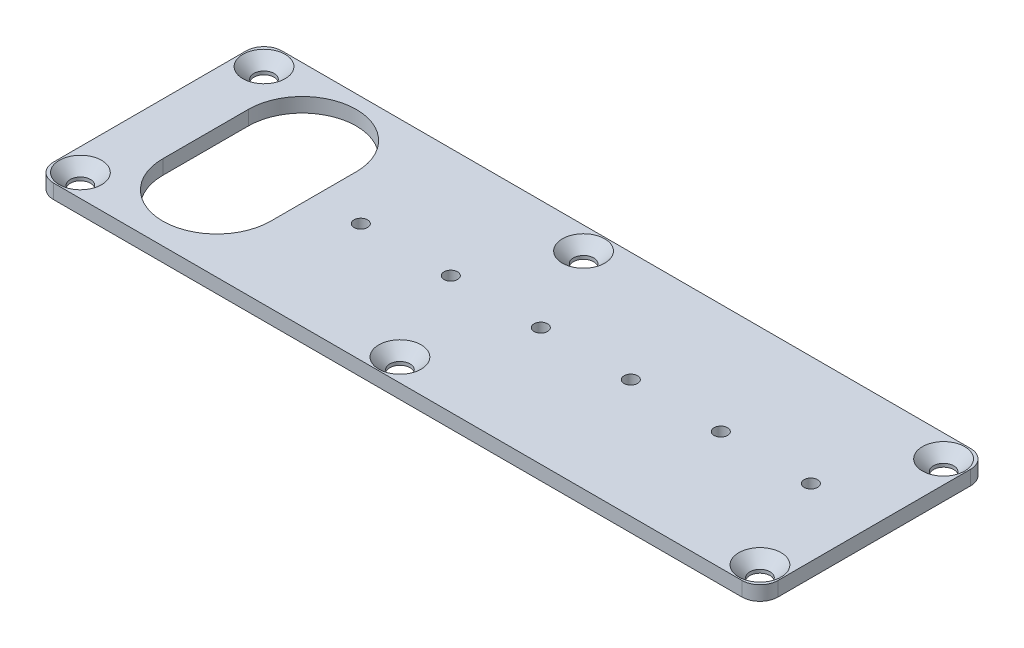
from build123d import *

# Parameters (mm, degrees)
SKETCH1_W                                       = 161
SKETCH1_H                                       = 50.8
BOSS_EXTRUDE1_DEPTH                             = 3.2
SKETCH2_R                                       = 1.5
CUT_EXTRUDE2_DEPTH                              = 169.854612019
FILLET1_R                                       = 4
CSK_FOR_M4_FLAT_HEAD_MACHINE_SCREW1_D           = 4.5
CSK_FOR_M4_FLAT_HEAD_MACHINE_SCREW1_DEPTH       = 5
CSK_FOR_M4_FLAT_HEAD_MACHINE_SCREW1_CSINK_D     = 9.4
CSK_FOR_M4_FLAT_HEAD_MACHINE_SCREW1_CSINK_ANGLE = 90
CSK_FOR_M4_FLAT_HEAD_MACHINE_SCREW1_TIP         = 1.351936393


with BuildPart() as part:
    # Sketch1 → Boss-Extrude1 (new body)
    with BuildSketch(Plane(origin=(0, 0, 0), x_dir=(1, 0, 0), z_dir=(0, 1, 0))):
        with Locations((80.5, 25.4)):
            Rectangle(SKETCH1_W, SKETCH1_H)
    extrude(amount=BOSS_EXTRUDE1_DEPTH)

    # Sketch2 → Cut-Extrude2 (cut, through all)
    with BuildSketch(Plane(origin=(0, 3.2, 0), x_dir=(1, 0, 0), z_dir=(0, 1, 0))):
        with Locations((146, 26.3)):
            Circle(SKETCH2_R)
        with Locations((126, 26.3)):
            Circle(SKETCH2_R)
        with Locations((106, 26.3)):
            Circle(SKETCH2_R)
        with Locations((86, 26.3)):
            Circle(SKETCH2_R)
        with Locations((66, 26.3)):
            Circle(SKETCH2_R)
        with Locations((46, 26.3)):
            Circle(SKETCH2_R)
        with BuildLine():
            Line((35.5, 35.8), (35.5, 16.8))
            ThreePointArc((35.5, 16.8), (23.5, 4.8), (11.5, 16.8))
            Line((11.5, 16.8), (11.5, 35.8))
            ThreePointArc((11.5, 35.8), (23.5, 47.8), (35.5, 35.8))
        make_face()
    extrude(amount=-CUT_EXTRUDE2_DEPTH, mode=Mode.SUBTRACT)

    # Fillet1
    fillet1_edges = [part.edges().sort_by_distance(p)[0] for p in [
        (161, 1.6, 0),
        (0, 1.6, 0),
        (0, 1.6, -50.8),
        (161, 1.6, -50.8),
    ]]
    fillet(fillet1_edges, radius=FILLET1_R)

    # CSK for M4 Flat Head Machine Screw1
    with Locations(Plane(origin=(0, 3.2, 0), x_dir=(1, 0, 0), z_dir=(0, 1, 0))):
        with Locations((156, 5), (76, 5), (5, 5), (5, 45.8), (76, 45.8), (156, 45.8)):
            CounterSinkHole(CSK_FOR_M4_FLAT_HEAD_MACHINE_SCREW1_D / 2, CSK_FOR_M4_FLAT_HEAD_MACHINE_SCREW1_CSINK_D / 2, depth=CSK_FOR_M4_FLAT_HEAD_MACHINE_SCREW1_DEPTH, counter_sink_angle=CSK_FOR_M4_FLAT_HEAD_MACHINE_SCREW1_CSINK_ANGLE)
            with Locations((0, 0, -(CSK_FOR_M4_FLAT_HEAD_MACHINE_SCREW1_DEPTH + CSK_FOR_M4_FLAT_HEAD_MACHINE_SCREW1_TIP / 2))):  # 118° drill point
                Cone(0, CSK_FOR_M4_FLAT_HEAD_MACHINE_SCREW1_D / 2, CSK_FOR_M4_FLAT_HEAD_MACHINE_SCREW1_TIP, mode=Mode.SUBTRACT)


solid = part.part
